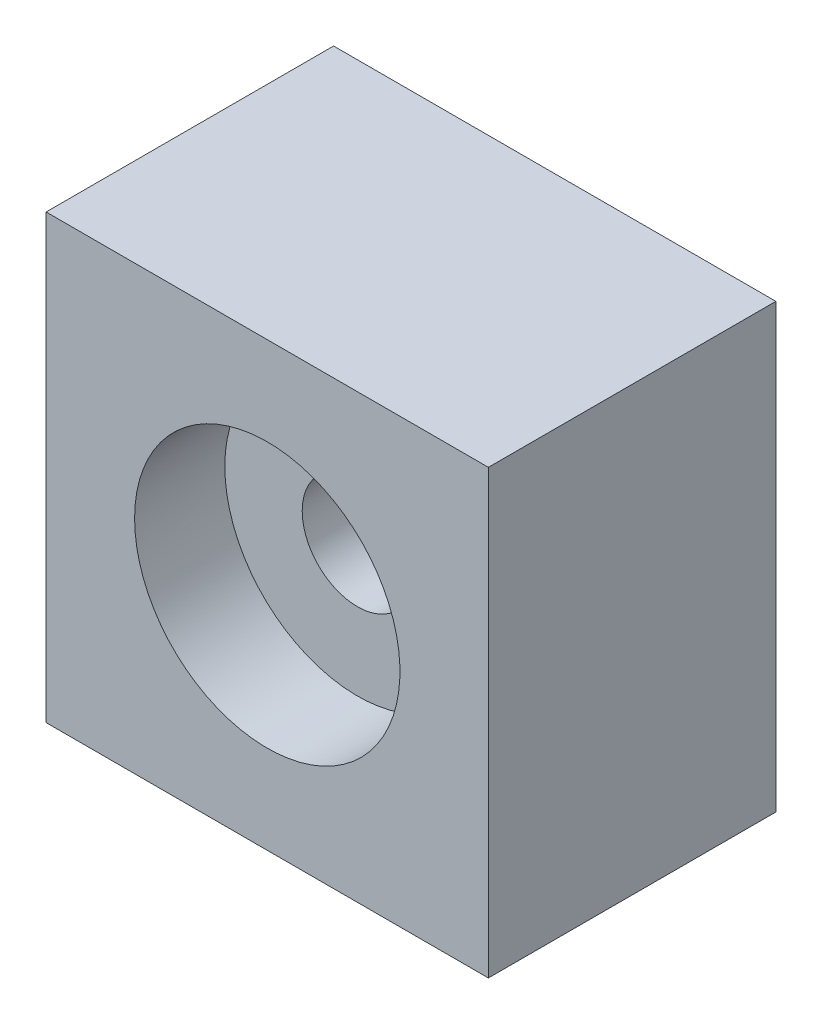
from build123d import *

# Parameters (mm, degrees)
SKETCH1_W           = 31.75
SKETCH1_H           = 31.75
BOSS_EXTRUDE1_DEPTH = 20.6375
SKETCH2_R           = 11.1125
CUT_EXTRUDE1_DEPTH  = 6.985
SKETCH3_R           = 8.255
CUT_EXTRUDE2_DEPTH  = 2.413
SKETCH4_R           = 3.96875
CUT_EXTRUDE3_DEPTH  = 26.106923552
CUT_EXTRUDE4_START  = -4.7625
SKETCH6_R           = 9.525
CUT_EXTRUDE4_DEPTH  = 21.344423552


with BuildPart() as part:
    # Sketch1 → Boss-Extrude1 (new body)
    with BuildSketch(Plane.XY):
        Rectangle(SKETCH1_W, SKETCH1_H)
    extrude(amount=BOSS_EXTRUDE1_DEPTH)

    # Sketch2 → Cut-Extrude1 (cut)
    with BuildSketch(Plane(origin=(0, 0, 0), x_dir=(-1, 0, 0), z_dir=(0, 0, -1))):
        Circle(SKETCH2_R)
    extrude(amount=-CUT_EXTRUDE1_DEPTH, mode=Mode.SUBTRACT)

    # Sketch3 → Cut-Extrude2 (cut)
    with BuildSketch(Plane(origin=(0, 0, 6.985), x_dir=(-1, 0, 0), z_dir=(0, 0, -1))):
        Circle(SKETCH3_R)
    extrude(amount=-CUT_EXTRUDE2_DEPTH, mode=Mode.SUBTRACT)

    # Sketch4 → Cut-Extrude3 (cut, through all)
    with BuildSketch(Plane(origin=(0, 0, 9.398), x_dir=(-1, 0, 0), z_dir=(0, 0, -1))):
        Circle(SKETCH4_R)
    extrude(amount=-CUT_EXTRUDE3_DEPTH, mode=Mode.SUBTRACT)

    # Sketch6 → Cut-Extrude4 (cut, through all)
    with BuildSketch(Plane(origin=(0, 0, 9.398), x_dir=(-1, 0, 0), z_dir=(0, 0, -1)).offset(CUT_EXTRUDE4_START)):
        Circle(SKETCH6_R)
    extrude(amount=-CUT_EXTRUDE4_DEPTH, mode=Mode.SUBTRACT)


solid = part.part
